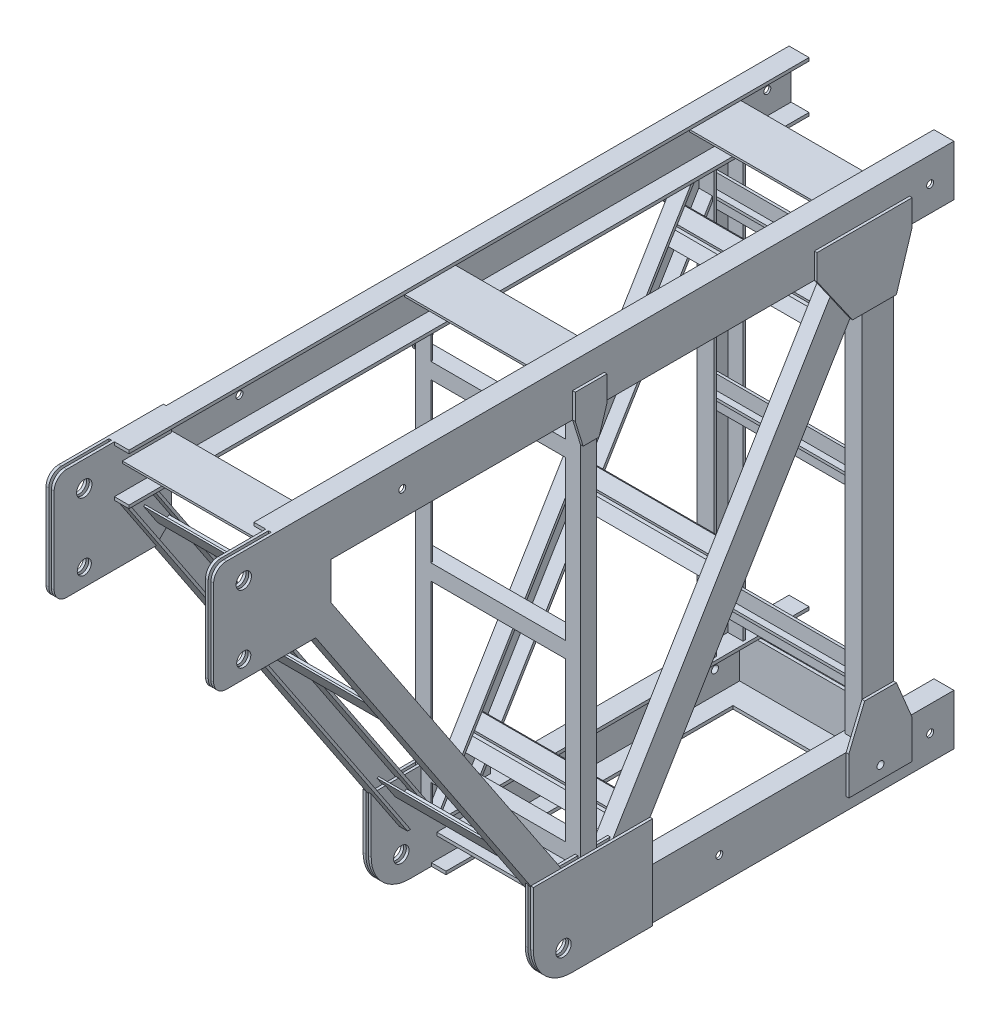
from build123d import *

# Parameters (mm, degrees)
EXTRUDE_1_DEPTH                   = 2335
EXTRUDE_1_2_DEPTH                 = 2335
PATTERN_LINEAR_2_COUNT            = 2
PATTERN_LINEAR_2_PITCH            = 1500
SKETCH_4_W                        = 520
SKETCH_4_H                        = 1000
CUT_EXTRUDE_2_DEPTH               = 1000
EXTRUDE_3_DEPTH                   = 520
SKETCH_8_W                        = 100
SKETCH_8_H                        = 1340
EXTRUDE_7_DEPTH                   = 520
CUT_EXTRUDE_9_DEPTH               = 1340
SKETCH_11_R                       = 11
CUT_EXTRUDE_10_DEPTH              = 2824.583715777
EXTRUDE_11_DEPTH                  = 48
PATTERN_LINEAR_3_COUNT            = 2
PATTERN_LINEAR_3_PITCH            = 472
CUT_EXTRUDE_12_DEPTH              = 42.7
CUT_EXTRUDE_13_DEPTH              = 42.7
EXTRUDE_14_DEPTH                  = 43
PATTERN_LINEAR_4_COUNT            = 2
PATTERN_LINEAR_4_PITCH            = 477
CUT_EXTRUDE_15_DEPTH              = 38
CUT_EXTRUDE_16_DEPTH              = 38
EXTRUDE_17_DEPTH                  = 520
SKETCH_19_W                       = 394
SKETCH_19_H                       = 50
CUT_EXTRUDE_18_DEPTH              = 2824.583715777
CUT_EXTRUDE_19_DEPTH              = 15
CUT_EXTRUDE_20_DEPTH              = 15
CUT_EXTRUDE_21_DEPTH              = 45
CUT_EXTRUDE_22_DEPTH              = 45
PATTERN_LINEAR_6_COUNT            = 3
PATTERN_LINEAR_6_PITCH            = 900
SKETCH_27_W                       = 520
SKETCH_27_H                       = 160
EXTRUDE_24_DEPTH                  = 10
SKETCH_28_W                       = 507
SKETCH_28_H                       = 10
EXTRUDE_25_DEPTH                  = 140
EXTRUDE_26_DEPTH                  = 520
PATTERN_LINEAR_9_COUNT            = 3
PATTERN_LINEAR_9_PITCH            = 550
EXTRUDE_27_DEPTH                  = 520
PATTERN_LINEAR_10_COUNT           = 3
PATTERN_LINEAR_10_PITCH           = 620
EXTRUDE_28_DEPTH                  = 520
SKETCH_32_W                       = 400
SKETCH_32_H                       = 5
EXTRUDE_29_DEPTH                  = 15
PATTERN_LINEAR_11_COUNT           = 3
PATTERN_LINEAR_11_PITCH           = 675
SKETCH_38_W                       = 520
SKETCH_38_H                       = 50
EXTRUDE_36_DEPTH                  = 50
SKETCH_38_2_W                     = 520
SKETCH_38_2_H                     = 50
EXTRUDE_37_DEPTH                  = 50
PATTERN_LINEAR_13_COUNT           = 3
PATTERN_LINEAR_13_PITCH           = 550
SKETCH_39_W                       = 514
SKETCH_39_H                       = 45
CUT_EXTRUDE_38_DEPTH              = 45
SKETCH_40_W                       = 376.547087515
SKETCH_40_H                       = 292.888974491
EXTRUDE_39_DEPTH                  = 8.5
PATTERN_LINEAR_15_COUNT           = 2
PATTERN_LINEAR_15_PITCH           = 17
PATTERN_LINEAR_16_COUNT           = 2
PATTERN_LINEAR_16_PITCH           = 511.5
PATTERN_LINEAR_16_COPY_1_SKETCH_W = 376.547087515
PATTERN_LINEAR_16_COPY_1_SKETCH_H = 292.888974491
PATTERN_LINEAR_16_COPY_1_DEPTH    = 8.5
SKETCH_41_W                       = 8.5
SKETCH_41_H                       = 160
SKETCH_41_W_2                     = 486
CUT_EXTRUDE_40_DEPTH              = 190
SKETCH_42_W                       = 160
SKETCH_42_H                       = 10
EXTRUDE_41_DEPTH                  = 501.5
FILLET_1_R                        = 120
SKETCH_43_R                       = 24.25
CUT_EXTRUDE_42_DEPTH              = 2827.763874115
SKETCH_44_W                       = 370
SKETCH_44_H                       = 350
EXTRUDE_43_DEPTH                  = 8.5
PATTERN_LINEAR_17_COUNT           = 2
PATTERN_LINEAR_17_PITCH           = 17
SKETCH_45_W                       = 8.5
SKETCH_45_H                       = 350
SKETCH_45_W_2                     = 496.5
CUT_EXTRUDE_44_DEPTH              = 190
CHAMFER_1_SIZE                    = 50
SKETCH_46_R                       = 24.25
CUT_EXTRUDE_45_DEPTH              = 2827.763874115
EXTRUDE_46_DEPTH                  = 8.5
PATTERN_LINEAR_19_COUNT           = 2
PATTERN_LINEAR_19_PITCH           = 528.5
SKETCH_49_W                       = 8.5
SKETCH_49_H                       = 370
EXTRUDE_48_DEPTH                  = 350
CUT_EXTRUDE_50_DEPTH              = 8.5
PATTERN_LINEAR_21_COUNT           = 2
PATTERN_LINEAR_21_PITCH           = 17
SKETCH_52_R                       = 24.25
SKETCH_52_R_2                     = 22.25
CUT_EXTRUDE_54_DEPTH              = 2826.161455563
FILLET_2_R                        = 40
SKETCH_53_R                       = 11
CUT_EXTRUDE_55_DEPTH              = 2827.763874115


with BuildPart() as part:
    # 草图2 → 拉伸1 (new body)
    with BuildSketch(Plane.XY):
        Polygon((0, 0), (0, 160), (63, 160), (63, 150), (6.5, 150), (6.5, 10), (63, 10), (63, 0), align=None)
    extrude_1 = extrude(amount=EXTRUDE_1_DEPTH)



with BuildPart() as body_2:
    # 草图2 → Extrude 1 2 (new body)
    with BuildSketch(Plane.XY):
        Polygon((457, 160), (520, 160), (520, 0), (457, 0), (457, 10), (513.5, 10), (513.5, 150), (457, 150), align=None)
    extrude_1_2 = extrude(amount=EXTRUDE_1_2_DEPTH)


with BuildPart() as pattern_linear_2_1:
    # 阵列(线性)2: pattern copy
    add(extrude_1.moved(Location(Vector(0, -1, 0) * (1 * PATTERN_LINEAR_2_PITCH))))


with BuildPart() as pattern_linear_2_2:
    # 阵列(线性)2: pattern copy
    add(extrude_1_2.moved(Location(Vector(0, -1, 0) * (1 * PATTERN_LINEAR_2_PITCH))))


with BuildPart() as cut_extrude_2_tool:
    # 草图4 → 拉伸2 (new body)
    with BuildSketch(Plane(origin=(0, -1340, 0), x_dir=(1, 0, 0), z_dir=(0, 1, 0))):
        with Locations((260, -1835)):
            Rectangle(SKETCH_4_W, SKETCH_4_H)
    extrude(amount=-CUT_EXTRUDE_2_DEPTH)


with BuildPart() as pattern_linear_2_1_1:
    add(pattern_linear_2_1.part)

    # 拉伸2: cut by cut_extrude_2_tool
    add(cut_extrude_2_tool.part, mode=Mode.SUBTRACT)


with BuildPart() as pattern_linear_2_2_1:
    add(pattern_linear_2_2.part)

    # 拉伸2: cut by cut_extrude_2_tool
    add(cut_extrude_2_tool.part, mode=Mode.SUBTRACT)


with BuildPart() as part_1:
    add(part.part)

    add(body_2.part)  # 拉伸3 merges body 2
    # 草图5 → 拉伸3 (add)
    with BuildSketch(Plane.ZY):
        Polygon((160, 95), (320, 95), (320, 88.5), (243.25, 88.5), (243.25, 48.5), (236.75, 48.5), (236.75, 88.5), (160, 88.5), align=None)
    extrude_3 = extrude(amount=-EXTRUDE_3_DEPTH)

    # 草图11 → 拉伸10 (cut, through all)
    with BuildSketch(Plane.ZY):
        with Locations((2240, 80)):
            Circle(SKETCH_11_R)
    extrude(amount=-CUT_EXTRUDE_10_DEPTH, mode=Mode.SUBTRACT)


    add(pattern_linear_2_1_1.part)  # 拉伸11 merges 阵列(线性)2_1


with BuildPart() as body_4:
    # 草图8 → 拉伸7 (new body)
    with BuildSketch(Plane.ZY):
        with Locations((240, -670)):
            Rectangle(SKETCH_8_W, SKETCH_8_H)
    extrude(amount=-EXTRUDE_7_DEPTH)

    # 草图10 → 拉伸9 (cut)
    with BuildSketch(Plane.XZ.offset(1340)):
        Polygon((466.7, 290), (466.7, 281.5), (514.7, 281.5), (514.7, 198.5), (466.7, 198.5), (466.7, 190), (53.3, 190), (53.3, 198.5), (5.3, 198.5), (5.3, 281.5), (53.3, 281.5), (53.3, 290), align=None)
    extrude(amount=-CUT_EXTRUDE_9_DEPTH, mode=Mode.SUBTRACT)


with BuildPart() as cut_extrude_9_piece_1:
    # of the separate pieces the step leaves, piece 1, a body of its own (cut_extrude_9_pieces)
    add(body_4.part.solids().sort_by_distance((0, 0, 190))[0])


with BuildPart() as cut_extrude_9_piece_2:
    # of the separate pieces the step leaves, piece 2, a body of its own (cut_extrude_9_pieces)
    add(body_4.part.solids().sort_by_distance((466.7, 0, 198.5))[0])


with BuildPart() as part_2:
    add(part_1.part)

    add(cut_extrude_9_piece_1.part)  # 拉伸11 merges 拉伸9 piece 1
    # 草图12 → 拉伸11 (add)
    with BuildSketch(Plane.ZY):
        Polygon((290, 0), (348.363937381, 0), (1155.194923297, -1340), (1038.467048534, -1340), (290, -96.931919394), align=None)
    extrude_11 = extrude(amount=-EXTRUDE_11_DEPTH)


    add(pattern_linear_2_2_1.part)  # 阵列(线性)3 merges 阵列(线性)2_2

    add(cut_extrude_9_piece_2.part)  # 阵列(线性)3 merges 拉伸9 piece 2
    # 阵列(线性)3: 拉伸11 ×2
    with Locations(*[(i * PATTERN_LINEAR_3_PITCH, 0, 0) for i in range(1, PATTERN_LINEAR_3_COUNT)]):
        add(extrude_11)

    # 草图13 → 拉伸12 (cut)
    with BuildSketch(Plane(origin=(48, 0, 0), x_dir=(0, 0, -1), z_dir=(1, 0, 0))):
        Polygon((-338.442068027, 0), (-290, 0), (-290, -80.453493097), (-1048.388917889, -1340), (-1145.273053942, -1340), align=None)
    extrude(amount=-CUT_EXTRUDE_12_DEPTH, mode=Mode.SUBTRACT)

    # 草图14 → 拉伸13 (cut)
    with BuildSketch(Plane.ZY.offset(-472)):
        Polygon((290, -80.453493097), (290, 0), (338.442068027, 0), (1145.273053942, -1340), (1048.388917889, -1340), align=None)
    extrude(amount=-CUT_EXTRUDE_13_DEPTH, mode=Mode.SUBTRACT)

    # 草图15 → 拉伸14 (add)
    with BuildSketch(Plane.ZY):
        Polygon((2091.666666667, 0), (2043.59264966, 0), (1152.852678731, -1336.109956394), (1155.194923297, -1340), (1246.40735034, -1340), (2139.740683673, 0), align=None)
    extrude_14 = extrude(amount=-EXTRUDE_14_DEPTH)

    # 阵列(线性)4: 拉伸14 ×2
    with Locations(*[(i * PATTERN_LINEAR_4_PITCH, 0, 0) for i in range(1, PATTERN_LINEAR_4_COUNT)]):
        add(extrude_14)

    # 草图16 → 拉伸15 (cut)
    with BuildSketch(Plane.ZY.offset(-477)):
        Polygon((2053.207453062, 0), (2130.125880272, 0), (1236.792546938, -1340), (1159.874119728, -1340), align=None)
    extrude(amount=-CUT_EXTRUDE_15_DEPTH, mode=Mode.SUBTRACT)

    # 草图17 → 拉伸16 (cut)
    with BuildSketch(Plane(origin=(43, 0, 0), x_dir=(0, 0, -1), z_dir=(1, 0, 0))):
        Polygon((-2130.125880272, 0), (-2053.207453062, 0), (-1159.874119728, -1340), (-1236.792546938, -1340), align=None)
    extrude(amount=-CUT_EXTRUDE_16_DEPTH, mode=Mode.SUBTRACT)

    # 阵列(线性)6: 拉伸3 ×3
    with Locations(*[(0, 0, i * PATTERN_LINEAR_6_PITCH) for i in range(1, PATTERN_LINEAR_6_COUNT)]):
        add(extrude_3)

    # 草图27 → 拉伸24 (add)
    with BuildSketch(Plane.XZ.offset(1500)):
        with Locations((260, 160)):
            Rectangle(SKETCH_27_W, SKETCH_27_H)
    extrude(amount=-EXTRUDE_24_DEPTH)

    # 草图28 → 拉伸25 (add)
    with BuildSketch(Plane(origin=(0, -1490, 0), x_dir=(1, 0, 0), z_dir=(0, 1, 0))):
        with Locations((260, -157.5)):
            Rectangle(SKETCH_28_W, SKETCH_28_H)
    extrude(amount=EXTRUDE_25_DEPTH)

    # 草图29 → 拉伸26 (add)
    with BuildSketch(Plane.ZY):
        Polygon((231.5, -1160), (231.5, -1260), (240, -1260), (240, -1214.25), (260, -1214.25), (260, -1205.75), (240, -1205.75), (240, -1160), align=None)
    extrude_26 = extrude(amount=-EXTRUDE_26_DEPTH)

    # 阵列(线性)9: 拉伸26 ×3
    with Locations(*[(0, i * PATTERN_LINEAR_9_PITCH, 0) for i in range(1, PATTERN_LINEAR_9_COUNT)]):
        add(extrude_26)

    # 草图30 → 拉伸27 (add)
    with BuildSketch(Plane.ZY):
        Polygon((339.513449924, -98.711290498), (391.096045536, -184.380630579), (398.377939443, -179.996109952), (374.77890195, -140.802386865), (391.912769966, -130.485867742), (387.528249339, -123.203973835), (370.394381323, -133.520492958), (346.795343831, -94.326769871), align=None)
    extrude_27 = extrude(amount=-EXTRUDE_27_DEPTH)

    # 阵列(线性)10: 拉伸27 ×3
    with Locations(*[Vector(0, -0.8566934008099668, 0.5158259561214942) * (i * PATTERN_LINEAR_10_PITCH) for i in range(1, PATTERN_LINEAR_10_COUNT)]):
        add(extrude_27)

    # 草图31 → 拉伸28 (add)
    with BuildSketch(Plane(origin=(520, 0, 0), x_dir=(0, 0, -1), z_dir=(1, 0, 0))):
        Polygon((-2048.908526541, -59.630271094), (-2004.532510843, -126.194294641), (-2008.692762315, -128.967795622), (-2053.068778013, -62.403772075), align=None)
    extrude_28 = extrude(amount=-EXTRUDE_28_DEPTH)

    # 草图32 → 拉伸29 (add)
    with BuildSketch(Plane(origin=(0, -963.997864894, 1445.996797341), x_dir=(-1, 0, 0), z_dir=(0, 0.5547001962252278, -0.8320502943378446))):
        with Locations((-260, 1046.914577104)):
            Rectangle(SKETCH_32_W, SKETCH_32_H)
    extrude_29 = extrude(amount=EXTRUDE_29_DEPTH)

    # 阵列(线性)11: 拉伸28, 拉伸29 ×3
    with Locations(*[Vector(0, -0.832050294337844, -0.5547001962252287) * (i * PATTERN_LINEAR_11_PITCH) for i in range(1, PATTERN_LINEAR_11_COUNT)]):
        add(extrude_28)
        add(extrude_29)


with BuildPart() as body_2_2:
    # 草图18 → 拉伸17 (new body)
    with BuildSketch(Plane.ZY):
        Polygon((1127.852678731, 0), (1177.852678731, 0), (1177.852678731, -1298.609956394), (1152.852678731, -1336.109956394), (1127.852678731, -1294.589488558), align=None)
    extrude(amount=-EXTRUDE_17_DEPTH)

    # 草图19 → 拉伸18 (cut, through all)
    with BuildSketch(Plane(origin=(0, 0, 0), x_dir=(1, 0, 0), z_dir=(0, 1, 0))):
        with Locations((260, -1152.852678731)):
            Rectangle(SKETCH_19_W, SKETCH_19_H)
    extrude(amount=-CUT_EXTRUDE_18_DEPTH, mode=Mode.SUBTRACT)


with BuildPart() as cut_extrude_18_piece_1:
    # of the separate pieces the step leaves, piece 1, a body of its own (cut_extrude_18_pieces)
    add(body_2_2.part.solids().sort_by_distance((0, 0, 1127.852678731))[0])

    # 草图21 → 拉伸20 (cut)
    with BuildSketch(Plane(origin=(63, 0, 0), x_dir=(0, 0, -1), z_dir=(1, 0, 0))):
        Polygon((-1177.852678731, -1298.609956394), (-1152.852678731, -1336.109956394), (-1127.852678731, -1294.589488558), (-1127.852678731, 0), (-1177.852678731, 0), align=None)
    extrude(amount=-CUT_EXTRUDE_20_DEPTH, mode=Mode.SUBTRACT)

    # 草图24 → 拉伸22 (cut)
    with BuildSketch(Plane(origin=(48, 0, 0), x_dir=(0, 0, -1), z_dir=(1, 0, 0))):
        Polygon((-1172.852678731, -1306.109956394), (-1152.852678731, -1336.109956394), (-1127.852678731, -1294.589488558), (-1127.852678731, 0), (-1172.852678731, 0), align=None)
    extrude(amount=-CUT_EXTRUDE_22_DEPTH, mode=Mode.SUBTRACT)


with BuildPart() as cut_extrude_18_piece_2:
    # of the separate pieces the step leaves, piece 2, a body of its own (cut_extrude_18_pieces)
    add(body_2_2.part.solids().sort_by_distance((457, 0, 1177.852678731))[0])

    # 草图20 → 拉伸19 (cut)
    with BuildSketch(Plane.ZY.offset(-457)):
        Polygon((1127.852678731, 0), (1177.852678731, 0), (1177.852678731, -1298.609956394), (1152.852678731, -1336.109956394), (1127.852678731, -1294.589488558), align=None)
    extrude(amount=-CUT_EXTRUDE_19_DEPTH, mode=Mode.SUBTRACT)

    # 草图23 → 拉伸21 (cut)
    with BuildSketch(Plane.ZY.offset(-472)):
        Polygon((1172.852678731, -1306.109956394), (1152.852678731, -1336.109956394), (1127.852678731, -1294.589488558), (1127.852678731, 0), (1172.852678731, 0), align=None)
    extrude(amount=-CUT_EXTRUDE_21_DEPTH, mode=Mode.SUBTRACT)


    add(cut_extrude_18_piece_1.part)  # 拉伸36 merges 拉伸18 piece 1

    add(part_2.part)  # 拉伸36 merges part
    # 草图38 → 拉伸36 (add)
    with BuildSketch(Plane.XY.offset(1177.852678731)):
        with Locations((260, -1213.609956394)):
            Rectangle(SKETCH_38_W, SKETCH_38_H)
    extrude(amount=-EXTRUDE_36_DEPTH)

    # 草图38<2> → 拉伸37 (add)
    with BuildSketch(Plane.XY.offset(1177.852678731)):
        with Locations((260, -1213.609956394)):
            Rectangle(SKETCH_38_2_W, SKETCH_38_2_H)
    extrude_37 = extrude(amount=-EXTRUDE_37_DEPTH)

    # 阵列(线性)13: 拉伸37 ×3
    with Locations(*[(0, i * PATTERN_LINEAR_13_PITCH, 0) for i in range(1, PATTERN_LINEAR_13_COUNT)]):
        add(extrude_37)

    # 草图39 → 拉伸38 (cut)
    with BuildSketch(Plane(origin=(0, 0, 1127.852678731), x_dir=(-1, 0, 0), z_dir=(0, 0, -1))):
        with Locations((-260, -1216.109956394)):
            Rectangle(SKETCH_39_W, SKETCH_39_H)
        with Locations((-260, -666.109956394)):
            Rectangle(SKETCH_39_W, SKETCH_39_H)
        with Locations((-260, -116.109956394)):
            Rectangle(SKETCH_39_W, SKETCH_39_H)
    extrude(amount=-CUT_EXTRUDE_38_DEPTH, mode=Mode.SUBTRACT)

    # 草图40 → 拉伸39 (add)
    with BuildSketch(Plane(origin=(520, 0, 0), x_dir=(0, 0, -1), z_dir=(1, 0, 0))):
        with Locations((-1146.726456243, -1353.555512754)):
            Rectangle(SKETCH_40_W, SKETCH_40_H)
    extrude_39 = extrude(amount=EXTRUDE_39_DEPTH)

    # 阵列(线性)15: 拉伸39 ×2
    with Locations(*[(-i * PATTERN_LINEAR_15_PITCH, 0, 0) for i in range(1, PATTERN_LINEAR_15_COUNT)]):
        add(extrude_39)

    # 阵列(线性)16: 拉伸39 ×2
    with Locations(*[(-i * PATTERN_LINEAR_16_PITCH, 0, 0) for i in range(1, PATTERN_LINEAR_16_COUNT)]):
        add(extrude_39)

    # 阵列(线性)16 copy 1 sketch → 阵列(线性)16 copy 1 (add)
    with BuildSketch(Plane(origin=(-8.5, 0, 0), x_dir=(0, 0, -1), z_dir=(1, 0, 0))):
        with Locations((-1146.726456243, -1353.555512754)):
            Rectangle(PATTERN_LINEAR_16_COPY_1_SKETCH_W, PATTERN_LINEAR_16_COPY_1_SKETCH_H)
    extrude(amount=PATTERN_LINEAR_16_COPY_1_DEPTH)

    # 草图41 → 拉伸40 (cut)
    with BuildSketch(Plane.XY.offset(1335)):
        with Locations((4.25, -1420)):
            Rectangle(SKETCH_41_W, SKETCH_41_H)
        with Locations((260, -1420)):
            Rectangle(SKETCH_41_W_2, SKETCH_41_H)
        with Locations((515.75, -1420)):
            Rectangle(SKETCH_41_W, SKETCH_41_H)
    extrude(amount=-CUT_EXTRUDE_40_DEPTH, mode=Mode.SUBTRACT)

    # 草图42 → 拉伸41 (add)
    with BuildSketch(Plane.ZY.offset(-503)):
        with Locations((1047.852678731, -1420)):
            Rectangle(SKETCH_42_W, SKETCH_42_H)
    extrude(amount=EXTRUDE_41_DEPTH)

    # 圆角1
    fillet_1_edges = [cut_extrude_18_piece_2.edges().sort_by_distance(p)[0] for p in [
        (524.25, -1500, 1335),
        (-4.25, -1500, 1335),
        (12.75, -1500, 1335),
        (507.25, -1500, 1335),
    ]]
    fillet(fillet_1_edges, radius=FILLET_1_R)

    # 草图43 → 拉伸42 (cut, through all)
    with BuildSketch(Plane.ZY.offset(8.5)):
        with Locations((1240, -1420)):
            Circle(SKETCH_43_R)
    extrude(amount=-CUT_EXTRUDE_42_DEPTH, mode=Mode.SUBTRACT)

    # 草图44 → 拉伸43 (add)
    with BuildSketch(Plane.ZY):
        with Locations((2150, -15)):
            Rectangle(SKETCH_44_W, SKETCH_44_H)
    extrude_43 = extrude(amount=EXTRUDE_43_DEPTH)

    # 阵列(线性)17: 拉伸43 ×2
    with Locations(*[(i * PATTERN_LINEAR_17_PITCH, 0, 0) for i in range(1, PATTERN_LINEAR_17_COUNT)]):
        add(extrude_43)

    # 草图45 → 拉伸44 (cut)
    with BuildSketch(Plane.XY.offset(2335)):
        with Locations((4.25, -15)):
            Rectangle(SKETCH_45_W, SKETCH_45_H)
        with Locations((265.25, -15)):
            Rectangle(SKETCH_45_W_2, SKETCH_45_H)
    extrude(amount=-CUT_EXTRUDE_44_DEPTH, mode=Mode.SUBTRACT)

    # 倒角1
    # the kernel refuses this chamfer: 50 mm, written as the material it takes off along each edge
    with BuildSketch(Plane(origin=(128.584149398, -190, 1965), x_dir=(0, 0.9996219169112966, -0.027495876610586615), z_dir=(-1, 0, 0))) as chamfer_1_piece_1_section:
        Polygon((CHAMFER_1_SIZE * 0.999621916911, -CHAMFER_1_SIZE * 0.0274958766106), (-CHAMFER_1_SIZE * 0.0274958766106, -CHAMFER_1_SIZE * 0.999621916911), (0, 0), align=None)
    chamfer_1_piece_1 = extrude(amount=265.668298797, mode=Mode.PRIVATE)
    chamfer_1_piece_1 = split(chamfer_1_piece_1, bisect_by=Plane(origin=(5, -172.859199894, 1980.769211679), z_dir=(1, 0, 0)), keep=Keep.TOP, mode=Mode.PRIVATE)
    chamfer_1_piece_1 = split(chamfer_1_piece_1, bisect_by=Plane(origin=(12.75, -188.605600815, 2004.388813062), z_dir=(0, 0.554700196225229, -0.8320502943378437)), keep=Keep.TOP, mode=Mode.PRIVATE)
    add(chamfer_1_piece_1, mode=Mode.SUBTRACT)
    with BuildSketch(Plane(origin=(0, -190, 1965), x_dir=(0, 0.9996219169112966, -0.027495876610586587), z_dir=(-1, 0, 0))) as chamfer_1_piece_2:
        Polygon((CHAMFER_1_SIZE * 0.999621916911, -CHAMFER_1_SIZE * 0.0274958766106), (-CHAMFER_1_SIZE * 0.0274958766106, -CHAMFER_1_SIZE * 0.999621916911), (0, 0), align=None)
    extrude(amount=137.084149398, mode=Mode.SUBTRACT)
    with BuildSketch(Plane(origin=(145.584149398, -190, 1965), x_dir=(0, 0.9996219169112966, -0.027495876610586615), z_dir=(-1, 0, 0))) as chamfer_1_piece_3_section:
        Polygon((CHAMFER_1_SIZE * 0.999621916911, -CHAMFER_1_SIZE * 0.0274958766106), (-CHAMFER_1_SIZE * 0.0274958766106, -CHAMFER_1_SIZE * 0.999621916911), (0, 0), align=None)
    chamfer_1_piece_3 = extrude(amount=265.668298797, mode=Mode.PRIVATE)
    chamfer_1_piece_3 = split(chamfer_1_piece_3, bisect_by=Plane(origin=(5, -172.859199894, 1980.769211679), z_dir=(1, 0, 0)), keep=Keep.TOP, mode=Mode.PRIVATE)
    chamfer_1_piece_3 = split(chamfer_1_piece_3, bisect_by=Plane(origin=(12.75, -188.605600815, 2004.388813062), z_dir=(0, 0.554700196225229, -0.8320502943378437)), keep=Keep.TOP, mode=Mode.PRIVATE)
    add(chamfer_1_piece_3, mode=Mode.SUBTRACT)
    with BuildSketch(Plane(origin=(145.584149398, -190, 1965), x_dir=(0, 0.9996219169112966, -0.027495876610586615), z_dir=(-1, 0, 0))) as chamfer_1_piece_4_section:
        Polygon((CHAMFER_1_SIZE * 0.999621916911, -CHAMFER_1_SIZE * 0.0274958766106), (-CHAMFER_1_SIZE * 0.0274958766106, -CHAMFER_1_SIZE * 0.999621916911), (0, 0), align=None)
    chamfer_1_piece_4 = extrude(amount=265.668298797, mode=Mode.PRIVATE)
    chamfer_1_piece_4 = split(chamfer_1_piece_4, bisect_by=Plane(origin=(0, -172.859199894, 1980.769211679), z_dir=(-1, 0, 0)), keep=Keep.TOP, mode=Mode.PRIVATE)
    add(chamfer_1_piece_4, mode=Mode.SUBTRACT)

    # 草图46 → 拉伸45 (cut, through all)
    with BuildSketch(Plane.ZY.offset(8.5)):
        with Locations(Location((2240, 80, 0), (0, 0, 90))):
            Circle(SKETCH_46_R)
    extrude(amount=-CUT_EXTRUDE_45_DEPTH, mode=Mode.SUBTRACT)

    # 草图47 → 拉伸46 (add)
    with BuildSketch(Plane.ZY):
        Polygon((140, 80), (140, 0), (190, -160), (327.974090788, -160), (440, 0), (440, 80), align=None)
        Polygon((140, -1460), (340, -1460), (340, -1340), (290, -1220), (190, -1220), (140, -1340), align=None)
        Polygon((1102.852678731, 80), (1202.852678731, 80), (1202.852678731, 0), (1177.852678731, -80), (1127.852678731, -80), (1102.852678731, 0), align=None)
    extrude_46 = extrude(amount=EXTRUDE_46_DEPTH)

    # 阵列(线性)19: 拉伸46 ×2
    with Locations(*[(i * PATTERN_LINEAR_19_PITCH, 0, 0) for i in range(1, PATTERN_LINEAR_19_COUNT)]):
        add(extrude_46)

    # 草图49 → 拉伸48 (add)
    with BuildSketch(Plane(origin=(0, 160, 0), x_dir=(1, 0, 0), z_dir=(0, 1, 0))):
        with Locations((498.75, -2150)):
            Rectangle(SKETCH_49_W, SKETCH_49_H)
    extrude_48 = extrude(amount=-EXTRUDE_48_DEPTH)

    # 草图50 → 拉伸50 (cut)
    with BuildSketch(Plane.ZY.offset(-494.5)):
        Polygon((1965, -132.311179593), (1965, -190), (2003.459213605, -190), align=None)
    extrude(amount=-CUT_EXTRUDE_50_DEPTH, mode=Mode.SUBTRACT)

    # 阵列(线性)21: 拉伸48 ×2
    with Locations(*[(i * PATTERN_LINEAR_21_PITCH, 0, 0) for i in range(1, PATTERN_LINEAR_21_COUNT)]):
        add(extrude_48)

    # 草图52 → 拉伸54 (cut, through all)
    with BuildSketch(Plane(origin=(520, 0, 0), x_dir=(0, 0, -1), z_dir=(1, 0, 0))):
        with Locations(Location((-2240, 80, 0), (0, 0, 90))):
            Circle(SKETCH_52_R)
        with Locations((-2240, -135)):
            Circle(SKETCH_52_R_2)
    extrude(amount=-CUT_EXTRUDE_54_DEPTH, mode=Mode.SUBTRACT)

    # 圆角2
    fillet_2_edges = [cut_extrude_18_piece_2.edges().sort_by_distance(p)[0] for p in [
        (-4.25, -190, 2335),
        (12.75, -190, 2335),
        (-4.25, 160, 2335),
        (12.75, 160, 2335),
        (515.75, 160, 2335),
        (498.75, 160, 2335),
        (498.75, -190, 2335),
        (515.75, -190, 2335),
    ]]
    fillet(fillet_2_edges, radius=FILLET_2_R)

    # 草图53 → 拉伸55 (cut, through all)
    with BuildSketch(Plane.ZY.offset(8.5)):
        with Locations(Location((1740, 80, 0), (0, 0, 180))):
            Circle(SKETCH_53_R)
        with Locations(Location((740, -1420, 0), (0, 0, 180))):
            Circle(SKETCH_53_R)
        with Locations(Location((240, -1420, 0), (0, 0, 270))):
            Circle(SKETCH_53_R)
        with Locations(Location((75, -1420, 0), (0, 0, 270))):
            Circle(SKETCH_53_R)
        with Locations(Location((75, 80, 0), (0, 0, 180))):
            Circle(SKETCH_53_R)
    extrude(amount=-CUT_EXTRUDE_55_DEPTH, mode=Mode.SUBTRACT)


solid = cut_extrude_18_piece_2.part
